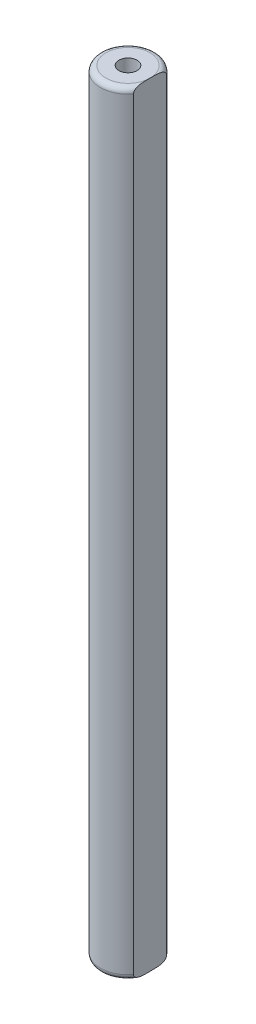
from build123d import *

# Parameters (mm, degrees)
SKETCH1_R            = 2.5
BOSS_EXTRUDE1_DEPTH  = 35.15
SKETCH2_R            = 0.825
CUT_EXTRUDE1_DEPTH   = 5
CUT_EXTRUDE2_DEPTH   = 36.327361917
FILLET1_R            = 0.5
FILLET1_OF_MIRROR1_R = 0.5


with BuildPart() as part:
    # Sketch1 → Boss-Extrude1 (new body)
    with BuildSketch(Plane(origin=(0, 0, 0), x_dir=(1, 0, 0), z_dir=(0, 1, 0))):
        with Locations(Location((0, 0, 0), (0, 0, 270))):
            Circle(SKETCH1_R)
    boss_extrude1 = extrude(amount=BOSS_EXTRUDE1_DEPTH)

    # Sketch2 → Cut-Extrude1 (cut)
    with BuildSketch(Plane(origin=(0, 35.15, 0), x_dir=(1, 0, 0), z_dir=(0, 1, 0))):
        with Locations(Location((0, 0, 0), (0, 0, 270))):
            Circle(SKETCH2_R)
    cut_extrude1 = extrude(amount=-CUT_EXTRUDE1_DEPTH, mode=Mode.SUBTRACT)

    # Sketch3 → Cut-Extrude2 (cut, through all)
    with BuildSketch(Plane(origin=(0, 35.15, 0), x_dir=(1, 0, 0), z_dir=(0, 1, 0))):
        with BuildLine():
            Line((2, 1.5), (2, -1.5))
            ThreePointArc((2, -1.5), (2.5, 0), (2, 1.5))
        make_face()
    cut_extrude2 = extrude(amount=-CUT_EXTRUDE2_DEPTH, mode=Mode.SUBTRACT)

    # Fillet1
    fillet1_edges = [part.edges().sort_by_distance(p)[0] for p in [
        (-2.5, 35.15, 0),
    ]]
    fillet(fillet1_edges, radius=FILLET1_R - 0.0001)  # a hair under: the kernel refuses the full size

    # Mirror1: Boss-Extrude1, Cut-Extrude1, Cut-Extrude2 across plane
    add(boss_extrude1.mirror(Plane.ZX))
    add(cut_extrude1.mirror(Plane.ZX), mode=Mode.SUBTRACT)
    add(cut_extrude2.mirror(Plane.ZX), mode=Mode.SUBTRACT)

    # Fillet1 of Mirror1
    fillet1_of_mirror1_edges = [part.edges().sort_by_distance(p)[0] for p in [
        (-2.5, -35.15, 0),
    ]]
    fillet(fillet1_of_mirror1_edges, radius=FILLET1_OF_MIRROR1_R - 0.0001)  # a hair under: the kernel refuses the full size


solid = part.part
